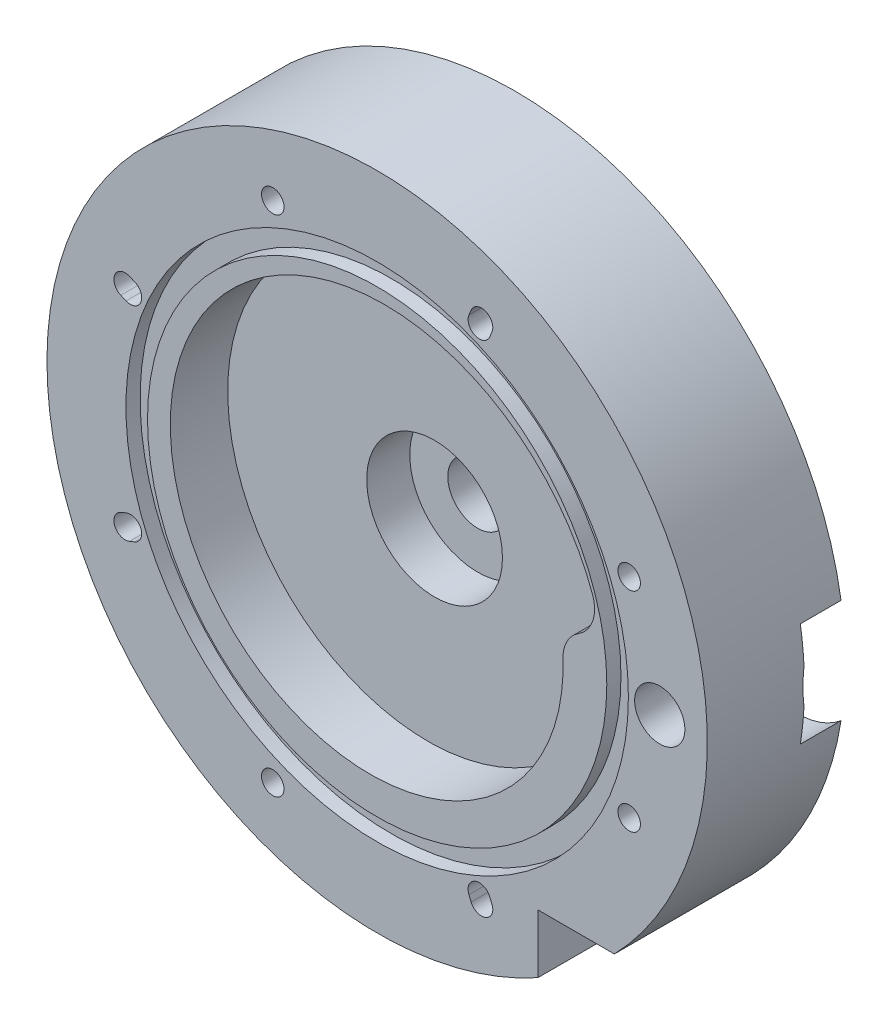
from build123d import *

# Parameters (mm, degrees)
SKETCH23_R                              = 39.2684
VOLUTE_CUT_DEPTH                        = 105.792316751
SKETCH28_W                              = 16.899609463
SKETCH28_H                              = 12.981949053
OUTLET_HOLE_CUT_DEPTH                   = 108.676978409
OUTLET_HOLE_D                           = 9.525
OUTLET_HOLE_DEPTH                       = 63.5
OUTLET_HOLE_TIP                         = 2.861598698
OUTLET_PIPE_THREAD_D                    = 14.2748
OUTLET_PIPE_THREAD_DEPTH                = 12.7
OUTLET_PIPE_THREAD_TIP                  = 4.288582582
CASING_FASTENER_HOLES_D                 = 4.9784
THERMAL_START                           = -17.78
THERMAL_CONTRACTION_SLOTTED_HOLES_DEPTH = 30.48
CIRPATTERN2_COUNT                       = 8
SKETCH16_R                              = 55.5625
SKETCH16_R_2                            = 50.7873
O_RING_GROOVE_DEPTH                     = 3.1369
CIRPATTERN3_COUNT                       = 8
SKETCH34_R                              = 17.4625
SKETCH34_R_2                            = 11.1125
CUT_EXTRUDE1_DEPTH                      = 3.175


# Read off the part's stored shape, not the designer's step: Thermal Contraction Slotted Holes
with BuildPart() as part:
    # Sketch22 → Main Body (revolve)
    with BuildSketch(Plane(origin=(0, 0, 0), x_dir=(1, 0, 0), z_dir=(0, 1, 0)), mode=Mode.PRIVATE) as main_body_sk:
        Polygon((-39.2684, 0), (-15.0125, 0), (-15.0125, 9.525), (-6.604, 9.525), (-6.604, 17.78), (-73.025, 17.78), (-73.025, -12.7), (-39.2684, -12.7), align=None)
    revolve(main_body_sk.sketch.rotate(Axis((0, 0, 0), (0, 0, -1)), 180), axis=Axis((0, 0, 0), (0, 0, -1)))

    # Sketch23 → Volute Cut (cut, through all)
    with BuildSketch(Plane.XY):
        with BuildLine():
            ThreePointArc((44.585991464, 6.651424093), (47.687720846, 10.629001226), (47.625380995, 15.672606956))
            add(Edge.make_bspline(
                [(41.089237213, 0), (41.091962531, -0.086157587), (41.097413749, -0.258491166), (41.10355964, -0.517077072), (41.10820678, -0.775748178), (41.11421023, -1.293415642), (41.109015311, -2.589274196), (41.017814103, -4.490313926), (40.7831208, -6.729807087), (40.462314107, -8.787506492), (40.037808727, -10.829994254), (39.510298345, -12.852043551), (38.880746853, -14.848458078), (38.15038378, -16.814086746), (37.320701547, -18.743836999), (36.393451781, -20.63268838), (35.370641466, -22.475705706), (34.254528452, -24.268052099), (33.047616433, -26.005001751), (31.752649319, -27.681952446), (30.372605018, -29.294437787), (28.910688618, -30.83813911), (27.370324987, -32.308897058), (25.755150794, -33.702722776), (24.069005972, -35.015808715), (22.315924639, -36.244539), (20.500125495, -37.385499343), (18.62600172, -38.435486481), (16.698110388, -39.3915171), (14.721161433, -40.250836227), (12.700006186, -41.010925075), (10.639625512, -41.669508306), (8.545117571, -42.224560694), (6.421685244, -42.674313186), (4.274623243, -43.017258312), (2.109304944, -43.252154961), (-0.068831028, -43.378032487), (-2.254294428, -43.394194133), (-4.441557201, -43.300219785), (-6.625067428, -43.095968006), (-8.799263397, -42.781577389), (-10.958587737, -42.35746718), (-13.097501591, -41.8243372), (-15.210498799, -41.183167044), (-17.292120038, -40.435214565), (-19.336966901, -39.582013644), (-21.339715858, -38.62537124), (-23.295132091, -37.567363743), (-25.198083132, -36.410332623), (-27.043552306, -35.156879378), (-28.826651909, -33.809859817), (-30.542636113, -32.372377659), (-32.186913551, -30.847777489), (-33.75505955, -29.239637062), (-35.242827981, -27.551758997), (-36.6461627, -25.788161864), (-37.961208531, -23.953070684), (-39.184321792, -22.050906876), (-40.312080298, -20.086277666), (-41.34129285, -18.063964982), (-42.269008156, -15.988913871), (-43.092523175, -13.866220454), (-43.809390856, -11.701119456), (-44.417427247, -9.498971339), (-44.914717965, -7.265249075), (-45.299623986, -5.005524575), (-45.570786769, -2.725454833), (-45.727132667, -0.430767795), (-45.767876634, 1.872751999), (-45.692525205, 4.179277959), (-45.500878745, 6.482956161), (-45.193032951, 8.777920163), (-44.76937961, 11.058305925), (-44.2306066, 13.318266753), (-43.577697135, 15.551988265), (-42.811928261, 17.753703317), (-41.934868588, 19.917706858), (-40.948375273, 22.038370685), (-39.854590259, 24.110158043), (-38.655935769, 26.127638043), (-37.35510908, 28.085499861), (-35.95507656, 29.978566677), (-34.45906702, 31.801809315), (-32.870564351, 33.550359561), (-31.193299507, 35.2195231), (-29.431241811, 36.804792072), (-27.58858964, 38.301857174), (-25.669760482, 39.706619311), (-23.67938041, 41.015200739), (-21.62227298, 42.22395569), (-19.503447594, 43.329480427), (-17.328087349, 44.32862273), (-15.101536401, 45.218490759), (-12.829286876, 45.996461288), (-10.51696536, 46.660187279), (-8.170319005, 47.207604779), (-5.795201275, 47.63693911), (-3.397557376, 47.946710349), (-0.983409407, 48.13573807), (1.441158736, 48.203145338), (3.870016668, 48.148361942), (6.297002983, 47.971126851), (8.715940862, 47.671489899), (11.120653763, 47.249812672), (13.504981164, 46.706768607), (15.862794321, 46.043342297), (18.188011992, 45.260827993), (20.47461609, 44.360827321), (22.71666723, 43.345246195), (24.908320125, 42.216290953), (27.043838787, 40.976463712), (29.117611505, 39.628556947), (31.12416555, 38.175647316), (33.058181574, 36.621088743), (34.914507669, 34.968504765), (36.688173034, 33.221780166), (38.374401232, 31.385051924), (39.968622994, 29.462699478), (41.466488529, 27.459334348), (42.863879321, 25.37978913), (44.156919368, 23.229105887), (45.341985843, 21.012523976), (46.415719137, 18.735467323), (47.152873419, 16.943563677), (47.537044371, 15.914838228), (47.625380995, 15.672606956)],
                knots=[0, 0, 0, 0, 0.000898736, 0.001797664, 0.002696784, 0.003596095, 0.007195255, 0.016206602, 0.023429565, 0.030664921, 0.03791271, 0.04517297, 0.052445735, 0.059731037, 0.067028905, 0.074339368, 0.081662453, 0.088998186, 0.096346593, 0.103707696, 0.111081519, 0.118468084, 0.125867414, 0.13327953, 0.140704451, 0.148142199, 0.155592793, 0.163056252, 0.170532595, 0.178021841, 0.185524007, 0.193039111, 0.200567171, 0.208108204, 0.215662226, 0.223229255, 0.230809306, 0.238402396, 0.24600854, 0.253627754, 0.261260054, 0.268905454, 0.27656397, 0.284235617, 0.291920409, 0.29961836, 0.307329485, 0.315053798, 0.322791313, 0.330542044, 0.338306004, 0.346083208, 0.353873668, 0.361677398, 0.369494411, 0.37732472, 0.385168337, 0.393025277, 0.400895551, 0.408779172, 0.416676152, 0.424586504, 0.432510241, 0.440447374, 0.448397915, 0.456361877, 0.464339271, 0.472330109, 0.480334403, 0.488352164, 0.496383405, 0.504428136, 0.512486369, 0.520558115, 0.528643386, 0.536742193, 0.544854546, 0.552980457, 0.561119937, 0.569272997, 0.577439648, 0.585619899, 0.593813763, 0.60202125, 0.61024237, 0.618477134, 0.626725552, 0.634987634, 0.643263392, 0.651552835, 0.659855974, 0.668172818, 0.676503379, 0.684847665, 0.693205688, 0.701577457, 0.709962981, 0.718362272, 0.726775338, 0.73520219, 0.743642837, 0.752097289, 0.760565555, 0.769047646, 0.777543571, 0.786053339, 0.79457696, 0.803114443, 0.811665798, 0.820231034, 0.828810161, 0.837403187, 0.846010122, 0.854630975, 0.863265756, 0.871914473, 0.880577136, 0.889253753, 0.897944334, 0.906648887, 0.915367423, 0.924099948, 0.932846474, 0.941607007, 0.944295232, 0.944295232, 0.944295232, 0.944295232], degree=3))
            ThreePointArc((41.089237213, 0), (41.960682048, 3.786728615), (44.585991464, 6.651424093))
        make_face()
        Circle(SKETCH23_R, mode=Mode.SUBTRACT)
    extrude(amount=VOLUTE_CUT_DEPTH, mode=Mode.SUBTRACT)

    # Sketch28 → Outlet Hole Cut (cut, through all)
    with BuildSketch(Plane.XY.offset(12.7)):
        with Locations((44.009804732, -57.290974527)):
            Rectangle(SKETCH28_W, SKETCH28_H)
    extrude(amount=-OUTLET_HOLE_CUT_DEPTH, mode=Mode.SUBTRACT)

    # Outlet Hole
    with Locations(Plane(origin=(45.286, -50.8, 3.5035), x_dir=(0, 0, -1), z_dir=(0, -1, 0))):
        with Locations((0, 0)):
            Hole(OUTLET_HOLE_D / 2, depth=OUTLET_HOLE_DEPTH)
            with Locations((0, 0, -(OUTLET_HOLE_DEPTH + OUTLET_HOLE_TIP / 2))):  # 118° drill point
                Cone(0, OUTLET_HOLE_D / 2, OUTLET_HOLE_TIP, mode=Mode.SUBTRACT)

    # Outlet Pipe Thread
    with Locations(Plane(origin=(45.286, -50.8, 3.5035), x_dir=(0, 0, -1), z_dir=(0, -1, 0))):
        with Locations((0, 0)):
            Hole(OUTLET_PIPE_THREAD_D / 2, depth=OUTLET_PIPE_THREAD_DEPTH)
            with Locations((0, 0, -(OUTLET_PIPE_THREAD_DEPTH + OUTLET_PIPE_THREAD_TIP / 2))):  # 118° drill point
                Cone(0, OUTLET_PIPE_THREAD_D / 2, OUTLET_PIPE_THREAD_TIP, mode=Mode.SUBTRACT)

    # Casing Fastener Holes (through all)
    with Locations(Plane(origin=(55.733032799, 23.085378057, -17.78), x_dir=(-1, 0, 0), z_dir=(0, 0, -1))):
        with Locations((0, 0)):
            casing_fastener_holes = Hole(CASING_FASTENER_HOLES_D / 2)

    # Thermal Contraction Slotted Holes outlin → Thermal Contraction Slotted Holes (cut)
    with BuildSketch(Plane.XY.offset(THERMAL_START)):
        with BuildLine():
            ThreePointArc((20.785657125, -56.685608399), (24.037953657, -58.032753731), (25.38509899, -54.780457199))
            Line((25.38509899, -54.780457199), (24.899091031, -53.607130193))
            ThreePointArc((24.899091031, -53.607130193), (21.646794499, -52.25998486), (20.299649166, -55.512281392))
            Line((20.299649166, -55.512281392), (20.785657125, -56.685608399))
        make_face()
    thermal_contraction_slotted_holes = extrude(amount=THERMAL_CONTRACTION_SLOTTED_HOLES_DEPTH, mode=Mode.SUBTRACT)

    # CirPattern2: Thermal Contraction Slotted Holes ×8 about axis, 4 skipped
    cirpattern2_axis = Axis((0, 0, 0), (0, 0, -1))
    add([thermal_contraction_slotted_holes.rotate(cirpattern2_axis, i * 360 / CIRPATTERN2_COUNT) for i in range(1, CIRPATTERN2_COUNT) if i not in (1, 4, 6, 7)], mode=Mode.SUBTRACT)

    # Sketch16 → O-Ring Groove (cut)
    with BuildSketch(Plane.XY.offset(12.7)):
        Circle(SKETCH16_R)
        Circle(SKETCH16_R_2, mode=Mode.SUBTRACT)
    extrude(amount=-O_RING_GROOVE_DEPTH, mode=Mode.SUBTRACT)

    # Sketch27 → Turbine Shaft Hole (revolve, cut)
    with BuildSketch(Plane.ZX, mode=Mode.PRIVATE) as turbine_shaft_hole_sk:
        Polygon((-5.572097567, 68.05625), (-8.78, 73.6125), (-8.78, 68.05625), align=None)
        Polygon((-8.78, 77.5), (-17.78, 77.5), (-17.78, 62.5), (12.7, 62.5), (12.7, 68.05625), (-5.572097567, 68.05625), (-8.78, 68.05625), (-8.78, 73.6125), align=None)
    revolve(turbine_shaft_hole_sk.sketch.rotate(Axis((62.5, 0, 12.7), (0, 0, -1)), 20.284940508), axis=Axis((62.5, 0, 12.7), (0, 0, -1)), mode=Mode.SUBTRACT)

    # CirPattern3: Casing Fastener Holes ×8 about axis, 4 skipped
    cirpattern3_axis = Axis((0, 0, 0), (0, 0, -1))
    add([casing_fastener_holes.rotate(cirpattern3_axis, i * 360 / CIRPATTERN3_COUNT) for i in range(1, CIRPATTERN3_COUNT) if i not in (2, 4, 5, 7)], mode=Mode.SUBTRACT)

    # Sketch34 → Cut-Extrude1 (cut)
    with BuildSketch(Plane(origin=(0, 0, -17.78), x_dir=(-1, 0, 0), z_dir=(0, 0, -1))):
        Circle(SKETCH34_R)
        Circle(SKETCH34_R_2, mode=Mode.SUBTRACT)
    extrude(amount=-CUT_EXTRUDE1_DEPTH, mode=Mode.SUBTRACT)


solid = part.part
